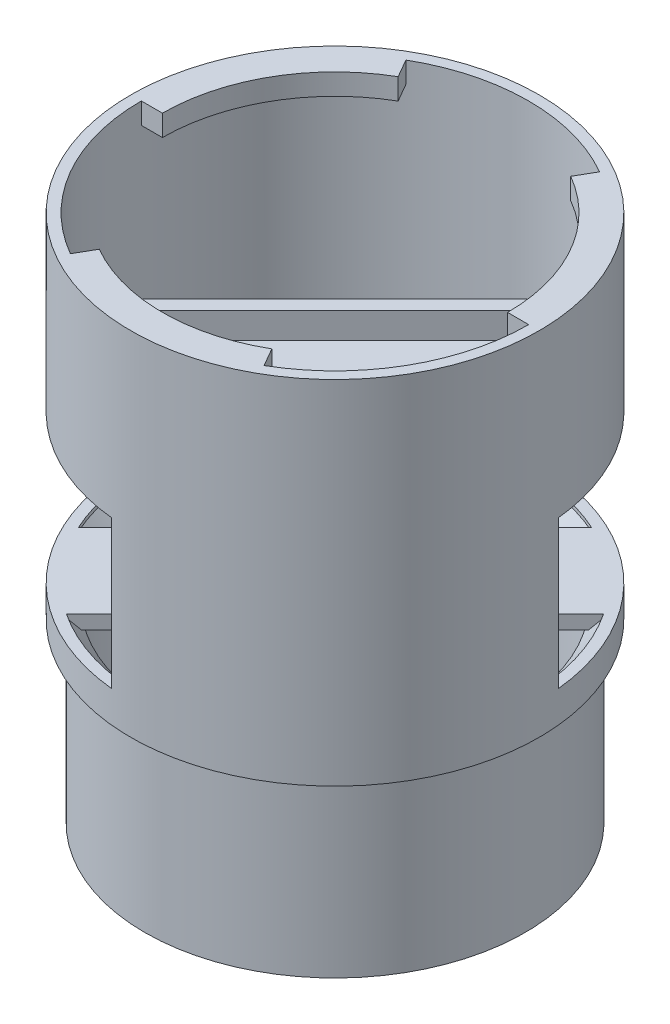
from build123d import *

# Parameters (mm, degrees)
SKETCH1_R                       = 27
SKETCH1_R_2                     = 25.5
BOSS_EXTRUDE3_DEPTH             = 25
SKETCH3_R                       = 1.75
SKETCH3_R_2                     = 5
BOSS_EXTRUDE4_DEPTH             = 6
CUT_EXTRUDE1_DEPTH              = 86.480992039
CUT_EXTRUDE1_DEPTH_BACK         = 86.480992039
SKETCH5_W                       = 36
SKETCH5_H                       = 21
BOSS_EXTRUDE6_REACH             = 87.481
SKETCH6_W                       = 2
SKETCH6_H                       = 21
SKETCH6_W_2                     = 15
SKETCH6_H_2                     = 2
SKETCH6_W_3                     = 15.441317486
BOSS_EXTRUDE6_DIRECTION_2_REACH = 87.481
BOSS_EXTRUDE7_START             = -3
BOSS_EXTRUDE7_DEPTH             = 3
CIRPATTERN1_COUNT               = 3
FILLET1_R                       = 10


with BuildPart() as part:
    # Sketch1 → Boss-Extrude3 (new body)
    with BuildSketch(Plane(origin=(0, 0, 0), x_dir=(1, 0, 0), z_dir=(0, 1, 0))):
        Circle(SKETCH1_R)
        Circle(SKETCH1_R_2, mode=Mode.SUBTRACT)
    extrude(amount=BOSS_EXTRUDE3_DEPTH)

    # Sketch3 → Boss-Extrude4 (add)
    with BuildSketch(Plane.XZ):
        with BuildLine():
            Line((-25.184320519, 4), (-14.456832295, 4))
            ThreePointArc((-14.456832295, 4), (-10.606601718, 10.606601718), (-4, 14.456832295))
            Line((-4, 14.456832295), (-4, 25.184320519))
            ThreePointArc((-4, 25.184320519), (0, 25.5), (4, 25.184320519))
            Line((4, 25.184320519), (4, 14.456832295))
            ThreePointArc((4, 14.456832295), (10.606601718, 10.606601718), (14.456832295, 4))
            Line((14.456832295, 4), (25.184320519, 4))
            ThreePointArc((25.184320519, 4), (25.5, 0), (25.184320519, -4))
            Line((25.184320519, -4), (14.456832295, -4))
            ThreePointArc((14.456832295, -4), (10.606601718, -10.606601718), (4, -14.456832295))
            Line((4, -14.456832295), (4, -25.184320519))
            ThreePointArc((4, -25.184320519), (0, -25.5), (-4, -25.184320519))
            Line((-4, -25.184320519), (-4, -14.456832295))
            ThreePointArc((-4, -14.456832295), (-10.606601718, -10.606601718), (-14.456832295, -4))
            Line((-14.456832295, -4), (-25.184320519, -4))
            ThreePointArc((-25.184320519, -4), (-25.5, 0), (-25.184320519, 4))
        make_face()
        with Locations((-10, 0)):
            Circle(SKETCH3_R, mode=Mode.SUBTRACT)
        with Locations((0, 10)):
            Circle(SKETCH3_R, mode=Mode.SUBTRACT)
        with Locations((10, 0)):
            Circle(SKETCH3_R, mode=Mode.SUBTRACT)
        with Locations((0, -10)):
            Circle(SKETCH3_R, mode=Mode.SUBTRACT)
        Circle(SKETCH3_R_2, mode=Mode.SUBTRACT)
    extrude(amount=-BOSS_EXTRUDE4_DEPTH)

    # Sketch4 → Revolve1 (revolve)
    with BuildSketch(Plane(origin=(0, 0, 0), x_dir=(0.7071067811865477, 0, 0.7071067811865475), z_dir=(-0.7071067811865475, 0, 0.7071067811865477))):
        Polygon((-27, 25), (-29, 25), (-29, 75), (-27.5, 75), (-27.5, 29), (-25.5, 27), (-25.5, 25), align=None)
    revolve(axis=Axis((0, 0, 0), (0, 1, 0)))

    # Sketch5 → Cut-Extrude1 (cut, two sides: drawn at the far end of the back side and taken through both)
    with BuildSketch(Plane(origin=(0, 0, 0), x_dir=(0.7071067811865477, 0, 0.7071067811865475), z_dir=(-0.7071067811865475, 0, 0.7071067811865477)).offset(-CUT_EXTRUDE1_DEPTH_BACK)):
        with Locations((0.3887064, 40)):
            Rectangle(SKETCH5_W, SKETCH5_H)
    extrude(amount=CUT_EXTRUDE1_DEPTH + CUT_EXTRUDE1_DEPTH_BACK, mode=Mode.SUBTRACT)

    # Sketch6 → Boss-Extrude6 (add, up to next)
    with BuildSketch(Plane(origin=(0, 0, 0), x_dir=(0.7071067811865477, 0, 0.7071067811865475), z_dir=(-0.7071067811865475, 0, 0.7071067811865477)), mode=Mode.PRIVATE) as boss_extrude6_sk1:
        with Locations((-18.6112936, 40)):
            Rectangle(SKETCH6_W, SKETCH6_H)
    boss_extrude6_tool1 = extrude(boss_extrude6_sk1.sketch, amount=-BOSS_EXTRUDE6_REACH, mode=Mode.PRIVATE) - part.part
    # Sketch6 → Boss-Extrude6 (add, up to next)
    with BuildSketch(Plane(origin=(0, 0, 0), x_dir=(0.7071067811865477, 0, 0.7071067811865475), z_dir=(-0.7071067811865475, 0, 0.7071067811865477)), mode=Mode.PRIVATE) as boss_extrude6_sk2:
        with Locations((-2.1112936, 28.5)):
            Rectangle(SKETCH6_W_2, SKETCH6_H_2)
    boss_extrude6_tool2 = extrude(boss_extrude6_sk2.sketch, amount=-BOSS_EXTRUDE6_REACH, mode=Mode.PRIVATE) - part.part
    # Sketch6 → Boss-Extrude6 (add, up to next)
    with BuildSketch(Plane(origin=(0, 0, 0), x_dir=(0.7071067811865477, 0, 0.7071067811865475), z_dir=(-0.7071067811865475, 0, 0.7071067811865477)), mode=Mode.PRIVATE) as boss_extrude6_sk3:
        with Locations((-1.890634857, 51.5)):
            Rectangle(SKETCH6_W_3, SKETCH6_H_2)
    boss_extrude6_tool3 = extrude(boss_extrude6_sk3.sketch, amount=-BOSS_EXTRUDE6_REACH, mode=Mode.PRIVATE) - part.part
    add(boss_extrude6_tool1.solids().sort_by_distance((-13.160172, 40, -13.160172))[0])
    add(boss_extrude6_tool2.solids().sort_by_distance((-1.49291, 28.5, -1.49291))[0])
    add(boss_extrude6_tool3.solids().sort_by_distance((-1.336881, 51.5, -1.336881))[0])

    # Sketch6 → Boss-Extrude6 direction 2 (add, up to next)
    with BuildSketch(Plane(origin=(0, 0, 0), x_dir=(0.7071067811865477, 0, 0.7071067811865475), z_dir=(-0.7071067811865475, 0, 0.7071067811865477)), mode=Mode.PRIVATE) as boss_extrude6_direction_2_sk1:
        with Locations((-18.6112936, 40)):
            Rectangle(SKETCH6_W, SKETCH6_H)
    boss_extrude6_direction_2_tool1 = extrude(boss_extrude6_direction_2_sk1.sketch, amount=BOSS_EXTRUDE6_DIRECTION_2_REACH, mode=Mode.PRIVATE) - part.part
    # Sketch6 → Boss-Extrude6 direction 2 (add, up to next)
    with BuildSketch(Plane(origin=(0, 0, 0), x_dir=(0.7071067811865477, 0, 0.7071067811865475), z_dir=(-0.7071067811865475, 0, 0.7071067811865477)), mode=Mode.PRIVATE) as boss_extrude6_direction_2_sk2:
        with Locations((-2.1112936, 28.5)):
            Rectangle(SKETCH6_W_2, SKETCH6_H_2)
    boss_extrude6_direction_2_tool2 = extrude(boss_extrude6_direction_2_sk2.sketch, amount=BOSS_EXTRUDE6_DIRECTION_2_REACH, mode=Mode.PRIVATE) - part.part
    # Sketch6 → Boss-Extrude6 direction 2 (add, up to next)
    with BuildSketch(Plane(origin=(0, 0, 0), x_dir=(0.7071067811865477, 0, 0.7071067811865475), z_dir=(-0.7071067811865475, 0, 0.7071067811865477)), mode=Mode.PRIVATE) as boss_extrude6_direction_2_sk3:
        with Locations((-1.890634857, 51.5)):
            Rectangle(SKETCH6_W_3, SKETCH6_H_2)
    boss_extrude6_direction_2_tool3 = extrude(boss_extrude6_direction_2_sk3.sketch, amount=BOSS_EXTRUDE6_DIRECTION_2_REACH, mode=Mode.PRIVATE) - part.part
    add(boss_extrude6_direction_2_tool1.solids().sort_by_distance((-13.160172, 40, -13.160172))[0])
    add(boss_extrude6_direction_2_tool2.solids().sort_by_distance((-1.49291, 28.5, -1.49291))[0])
    add(boss_extrude6_direction_2_tool3.solids().sort_by_distance((-1.336881, 51.5, -1.336881))[0])

    # Sketch7 → Boss-Extrude7 (add)
    with BuildSketch(Plane(origin=(0, 75, 0), x_dir=(1, 0, 0), z_dir=(0, 1, 0)).offset(BOSS_EXTRUDE7_START)):
        with BuildLine():
            Line((-27.5, 0), (-24.5, 0))
            ThreePointArc((-24.5, 0), (-21.217622393, 12.25), (-12.25, 21.217622393))
            Line((-12.25, 21.217622393), (-13.75, 23.815698604))
            ThreePointArc((-13.75, 23.815698604), (-23.815698604, 13.75), (-27.5, 0))
        make_face()
    boss_extrude7 = extrude(amount=BOSS_EXTRUDE7_DEPTH)

    # CirPattern1: Boss-Extrude7 ×3 about axis
    cirpattern1_axis = Axis((0, 75, 0), (0, -1, 0))
    for i in range(1, CIRPATTERN1_COUNT):
        add(boss_extrude7.rotate(cirpattern1_axis, i * 360 / CIRPATTERN1_COUNT))

    # Fillet1
    fillet1_edges = [part.edges().sort_by_distance(p)[0] for p in [
        (0, 6, 25.5),
        (-25.5, 6, 0),
        (0, 6, -25.5),
        (25.420957626, 6, -2.006218678),
    ]]
    fillet(fillet1_edges, radius=FILLET1_R)


solid = part.part
